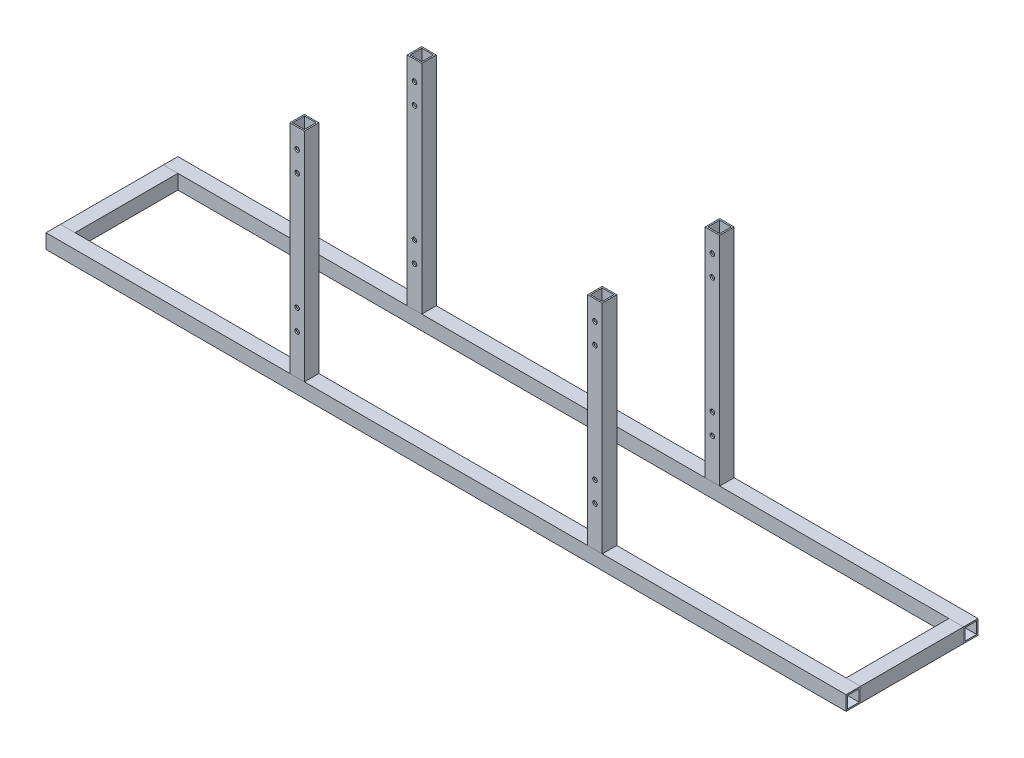
from build123d import *

# Parameters (mm, degrees)
SKETCH1_W                 = 12.7
SKETCH1_H                 = 12.7
BOSS_EXTRUDE1_DEPTH       = 45
BOSS_EXTRUDE1_2_DEPTH     = 45
SHELL1_T                  = -1.2
SHELL2_T                  = -1.2
BOSS_EXTRUDE2_START       = 45
SKETCH1_3_W               = 674.6
SKETCH1_3_H               = 12.7
SKETCH1_3_W_2             = 12.7
BOSS_EXTRUDE2_DEPTH       = 12.7
SHELL3_T                  = -1.2
EXTRUDE_THIN1_START       = 6.35
EXTRUDE_THIN1_OUTLINE_W   = 12.7
EXTRUDE_THIN1_OUTLINE_H   = 12.7
EXTRUDE_THIN1_OUTLINE_W_2 = 10.3
EXTRUDE_THIN1_OUTLINE_H_2 = 10.3
EXTRUDE_THIN1_DEPTH       = 190
CUT_EXTRUDE1_DEPTH        = 406.441256534
CUT_EXTRUDE1_DEPTH_BACK   = 406.441256534
SKETCH4_R                 = 2


# Read off the part's stored shape, not the designer's step: Extrude-Thin1
with BuildPart() as part:
    # Sketch1 → Boss-Extrude1 (new, symmetric)
    with BuildSketch(Plane.XY):
        with Locations((-343.65, 0)):
            Rectangle(SKETCH1_W, SKETCH1_H)
    extrude(amount=BOSS_EXTRUDE1_DEPTH, both=True)

    # Shell1
    shell1_openings = [part.faces().sort_by_distance(p)[0] for p in [
        (-343.65, 0, 45),
        (-343.65, 0, -45),
    ]]
    offset(amount=SHELL1_T, openings=shell1_openings, kind=Kind.INTERSECTION)


with BuildPart() as body_2:
    # Sketch1 → Boss-Extrude1 2 (new, symmetric)
    with BuildSketch(Plane.XY):
        with Locations((343.65, 0)):
            Rectangle(SKETCH1_W, SKETCH1_H)
    extrude(amount=BOSS_EXTRUDE1_2_DEPTH, both=True)

    # Shell2
    shell2_openings = [body_2.faces().sort_by_distance(p)[0] for p in [
        (343.65, 0, 45),
        (343.65, 0, -45),
    ]]
    offset(amount=SHELL2_T, openings=shell2_openings, kind=Kind.INTERSECTION)


with BuildPart() as body_3:
    # Sketch1<3> → Boss-Extrude2 (new body)
    with BuildSketch(Plane.XY.offset(BOSS_EXTRUDE2_START)):
        Rectangle(SKETCH1_3_W, SKETCH1_3_H)
        with Locations((-343.65, 0)):
            Rectangle(SKETCH1_3_W_2, SKETCH1_3_H)
        with Locations((343.65, 0)):
            Rectangle(SKETCH1_3_W_2, SKETCH1_3_H)
    extrude(amount=BOSS_EXTRUDE2_DEPTH)

    # Shell3
    shell3_openings = [body_3.faces().sort_by_distance(p)[0] for p in [
        (350, 0, 51.35),
        (-350, 0, 51.35),
    ]]
    offset(amount=SHELL3_T, openings=shell3_openings, kind=Kind.INTERSECTION)


with BuildPart() as body_4:
    # Mirror1: mirrored copy
    add(body_3.part.mirror(Plane.XY))


with BuildPart() as body_5:
    # Extrude-Thin1 outline → Extrude-Thin1 (new body)
    # profile 1 of 4: a face of its own
    with BuildSketch(Plane(origin=(0, 0, 0), x_dir=(1, 0, 0), z_dir=(0, 1, 0)).offset(EXTRUDE_THIN1_START)):
        with Locations((130.3, -51.35)):
            Rectangle(EXTRUDE_THIN1_OUTLINE_W, EXTRUDE_THIN1_OUTLINE_H)
        with Locations((130.3, -51.35)):
            Rectangle(EXTRUDE_THIN1_OUTLINE_W_2, EXTRUDE_THIN1_OUTLINE_H_2, mode=Mode.SUBTRACT)
    # profile 2 of 4: a face of its own
    with BuildSketch(Plane(origin=(0, 0, 0), x_dir=(1, 0, 0), z_dir=(0, 1, 0)).offset(EXTRUDE_THIN1_START)):
        with Locations((-130.3, -51.35)):
            Rectangle(EXTRUDE_THIN1_OUTLINE_W, EXTRUDE_THIN1_OUTLINE_H)
        with Locations((-130.3, -51.35)):
            Rectangle(EXTRUDE_THIN1_OUTLINE_W_2, EXTRUDE_THIN1_OUTLINE_H_2, mode=Mode.SUBTRACT)
    # profile 3 of 4: a face of its own
    with BuildSketch(Plane(origin=(0, 0, 0), x_dir=(1, 0, 0), z_dir=(0, 1, 0)).offset(EXTRUDE_THIN1_START)):
        with Locations((130.3, 51.35)):
            Rectangle(EXTRUDE_THIN1_OUTLINE_W, EXTRUDE_THIN1_OUTLINE_H)
        with Locations((130.3, 51.35)):
            Rectangle(EXTRUDE_THIN1_OUTLINE_W_2, EXTRUDE_THIN1_OUTLINE_H_2, mode=Mode.SUBTRACT)
    # profile 4 of 4: a face of its own
    with BuildSketch(Plane(origin=(0, 0, 0), x_dir=(1, 0, 0), z_dir=(0, 1, 0)).offset(EXTRUDE_THIN1_START)):
        with Locations((-130.3, 51.35)):
            Rectangle(EXTRUDE_THIN1_OUTLINE_W, EXTRUDE_THIN1_OUTLINE_H)
        with Locations((-130.3, 51.35)):
            Rectangle(EXTRUDE_THIN1_OUTLINE_W_2, EXTRUDE_THIN1_OUTLINE_H_2, mode=Mode.SUBTRACT)
    extrude(amount=EXTRUDE_THIN1_DEPTH)

    # Sketch4 → Cut-Extrude1 (cut, two sides: drawn at the far end of the back side and taken through both)
    with BuildSketch(Plane.XY.offset(-CUT_EXTRUDE1_DEPTH_BACK)):
        with Locations((-130.3, 41.35)):
            Circle(SKETCH4_R)
        with Locations((-130.3, 59.35)):
            Circle(SKETCH4_R)
        with Locations((-130.3, 179.35)):
            Circle(SKETCH4_R)
        with Locations((-130.3, 161.35)):
            Circle(SKETCH4_R)
        with Locations((130.3, 161.35)):
            Circle(SKETCH4_R)
        with Locations((130.3, 179.35)):
            Circle(SKETCH4_R)
        with Locations((130.3, 59.35)):
            Circle(SKETCH4_R)
        with Locations((130.3, 41.35)):
            Circle(SKETCH4_R)
    extrude(amount=CUT_EXTRUDE1_DEPTH + CUT_EXTRUDE1_DEPTH_BACK, mode=Mode.SUBTRACT)


solid = Compound([part.part, body_2.part, body_3.part, body_4.part, body_5.part])
